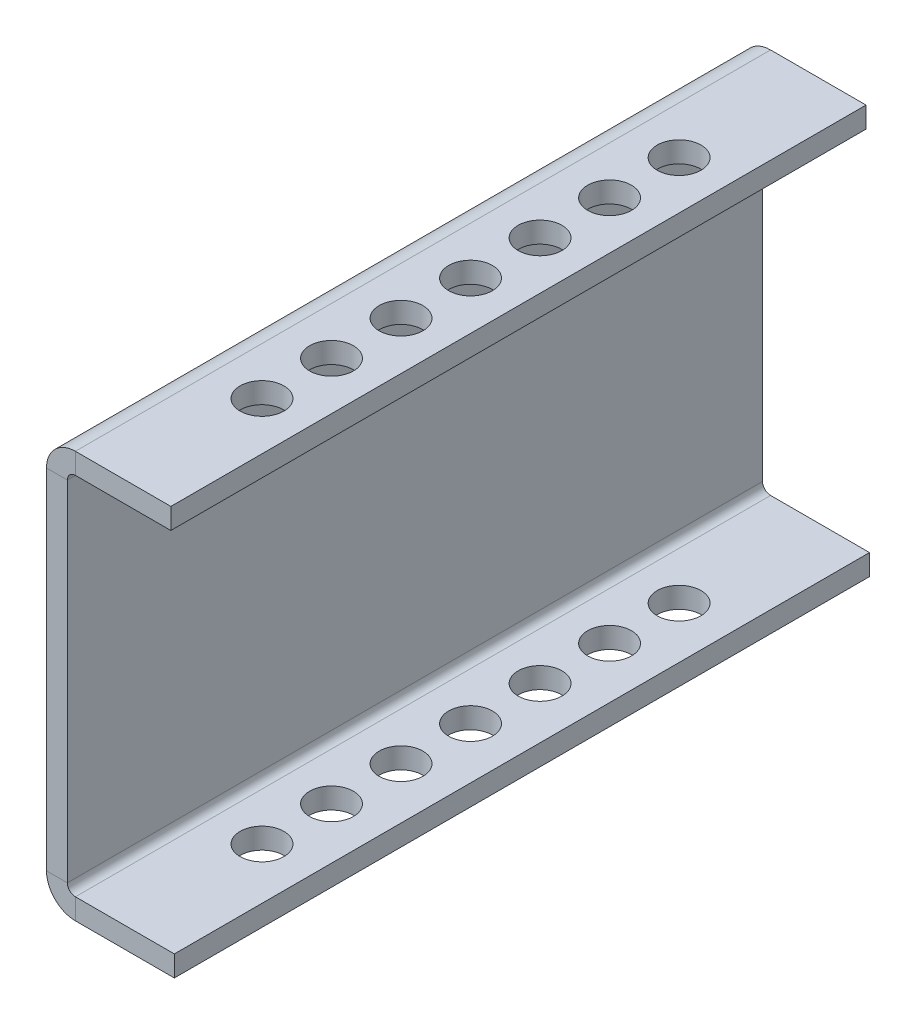
from build123d import *

# Parameters (mm, degrees)
SKETCH4_W              = 63.5
SKETCH4_H              = 54.9275
BASE_FLANGE1_DEPTH     = 1.905
SKETCHED_START         = -31.75
SKETCHED_BEND3_DEPTH   = 63.5
SKETCHED_BEND3_2_DEPTH = 63.5
CUT_EXTRUDE2_REACH     = 51.835
SKETCH20_R             = 2


# Read off the part's stored shape, not the designer's step: Sketched Bend3
# Sheet-metal steps are written as plain solids
with BuildPart() as part:
    # Sketch4 → Base-Flange1 (new body)
    with BuildSketch(Plane(origin=(0, 0, 0), x_dir=(0, 0, -1), z_dir=(1, 0, 0))):
        Rectangle(SKETCH4_W, SKETCH4_H)
    extrude(amount=-BASE_FLANGE1_DEPTH)

    # Sketched Bend3 outline → Sketched Bend3 (cut)
    with BuildSketch(Plane.XY.offset(SKETCHED_START)):
        with BuildLine():
            ThreePointArc((0, -18.310223013), (-1.375727285, -17.359629491), (-1.905, -15.7734))
            Line((-1.905, -15.7734), (-1.905, -27.46375))
            Line((-1.905, -27.46375), (0, -27.46375))
            Line((0, -27.46375), (0, -18.310223013))
        make_face()
        with BuildLine():
            Line((-1.905, 27.46375), (-1.905, 16.0909))
            ThreePointArc((-1.905, 16.0909), (-1.375727285, 17.677129491), (0, 18.627723013))
            Line((0, 18.627723013), (0, 27.46375))
            Line((0, 27.46375), (-1.905, 27.46375))
        make_face()
    extrude(amount=SKETCHED_BEND3_DEPTH, mode=Mode.SUBTRACT)

    # Sketched Bend3 2 outline → Sketched Bend3 2 (add)
    with BuildSketch(Plane.XY.offset(SKETCHED_START)):
        with BuildLine():
            Line((0, -15.7734), (0, -18.310223013))
            ThreePointArc((0, -18.310223013), (0.364592683, -18.388674577), (0.7366, -18.415))
            Line((0.7366, -18.415), (9.773717924, -18.415))
            Line((9.773717924, -18.415), (9.773717924, -16.51))
            Line((9.773717924, -16.51), (0.7366, -16.51))
            ThreePointArc((0.7366, -16.51), (0.215745145, -16.294254855), (0, -15.7734))
        make_face()
        with BuildLine():
            ThreePointArc((0.7366, 18.7325), (0.364592683, 18.706174577), (0, 18.627723013))
            Line((0, 18.627723013), (0, 16.0909))
            ThreePointArc((0, 16.0909), (0.215745145, 16.611754855), (0.7366, 16.8275))
            Line((0.7366, 16.8275), (9.456217924, 16.8275))
            Line((9.456217924, 16.8275), (9.456217924, 18.7325))
            Line((9.456217924, 18.7325), (0.7366, 18.7325))
        make_face()
    extrude(amount=SKETCHED_BEND3_2_DEPTH)

    # Cut-Extrude2: up to this face of the body (flat: up to its plane)
    cut_extrude2_end = Plane(part.part.faces().sort_by_distance((5.255158962, -18.415, 0))[0])
    # Sketch20 → Cut-Extrude2 (cut, up to the picked face)
    with BuildSketch(Plane(origin=(0, 18.7325, 0), x_dir=(1, 0, 0), z_dir=(0, 1, 0)), mode=Mode.PRIVATE) as cut_extrude2_sk1:
        with Locations(Location((5.08, -6.35, 0), (0, 0, 180))):
            Circle(SKETCH20_R)
    cut_extrude2_tool1 = split(extrude(cut_extrude2_sk1.sketch, amount=-CUT_EXTRUDE2_REACH, mode=Mode.PRIVATE), bisect_by=cut_extrude2_end, keep=Keep.BOTH, mode=Mode.PRIVATE)
    # Sketch20 → Cut-Extrude2 (cut, up to the picked face)
    with BuildSketch(Plane(origin=(0, 18.7325, 0), x_dir=(1, 0, 0), z_dir=(0, 1, 0)), mode=Mode.PRIVATE) as cut_extrude2_sk2:
        with Locations(Location((5.08, 0, 0), (0, 0, 180))):
            Circle(SKETCH20_R)
    cut_extrude2_tool2 = split(extrude(cut_extrude2_sk2.sketch, amount=-CUT_EXTRUDE2_REACH, mode=Mode.PRIVATE), bisect_by=cut_extrude2_end, keep=Keep.BOTH, mode=Mode.PRIVATE)
    # Sketch20 → Cut-Extrude2 (cut, up to the picked face)
    with BuildSketch(Plane(origin=(0, 18.7325, 0), x_dir=(1, 0, 0), z_dir=(0, 1, 0)), mode=Mode.PRIVATE) as cut_extrude2_sk3:
        with Locations(Location((5.08, 6.35, 0), (0, 0, 180))):
            Circle(SKETCH20_R)
    cut_extrude2_tool3 = split(extrude(cut_extrude2_sk3.sketch, amount=-CUT_EXTRUDE2_REACH, mode=Mode.PRIVATE), bisect_by=cut_extrude2_end, keep=Keep.BOTH, mode=Mode.PRIVATE)
    # Sketch20 → Cut-Extrude2 (cut, up to the picked face)
    with BuildSketch(Plane(origin=(0, 18.7325, 0), x_dir=(1, 0, 0), z_dir=(0, 1, 0)), mode=Mode.PRIVATE) as cut_extrude2_sk4:
        with Locations(Location((5.08, 12.7, 0), (0, 0, 180))):
            Circle(SKETCH20_R)
    cut_extrude2_tool4 = split(extrude(cut_extrude2_sk4.sketch, amount=-CUT_EXTRUDE2_REACH, mode=Mode.PRIVATE), bisect_by=cut_extrude2_end, keep=Keep.BOTH, mode=Mode.PRIVATE)
    # Sketch20 → Cut-Extrude2 (cut, up to the picked face)
    with BuildSketch(Plane(origin=(0, 18.7325, 0), x_dir=(1, 0, 0), z_dir=(0, 1, 0)), mode=Mode.PRIVATE) as cut_extrude2_sk5:
        with Locations(Location((5.08, 19.05, 0), (0, 0, 180))):
            Circle(SKETCH20_R)
    cut_extrude2_tool5 = split(extrude(cut_extrude2_sk5.sketch, amount=-CUT_EXTRUDE2_REACH, mode=Mode.PRIVATE), bisect_by=cut_extrude2_end, keep=Keep.BOTH, mode=Mode.PRIVATE)
    # Sketch20 → Cut-Extrude2 (cut, up to the picked face)
    with BuildSketch(Plane(origin=(0, 18.7325, 0), x_dir=(1, 0, 0), z_dir=(0, 1, 0)), mode=Mode.PRIVATE) as cut_extrude2_sk6:
        with Locations(Location((5.08, -12.7, 0), (0, 0, 180))):
            Circle(SKETCH20_R)
    cut_extrude2_tool6 = split(extrude(cut_extrude2_sk6.sketch, amount=-CUT_EXTRUDE2_REACH, mode=Mode.PRIVATE), bisect_by=cut_extrude2_end, keep=Keep.BOTH, mode=Mode.PRIVATE)
    # Sketch20 → Cut-Extrude2 (cut, up to the picked face)
    with BuildSketch(Plane(origin=(0, 18.7325, 0), x_dir=(1, 0, 0), z_dir=(0, 1, 0)), mode=Mode.PRIVATE) as cut_extrude2_sk7:
        with Locations(Location((5.08, -19.05, 0), (0, 0, 180))):
            Circle(SKETCH20_R)
    cut_extrude2_tool7 = split(extrude(cut_extrude2_sk7.sketch, amount=-CUT_EXTRUDE2_REACH, mode=Mode.PRIVATE), bisect_by=cut_extrude2_end, keep=Keep.BOTH, mode=Mode.PRIVATE)
    add(cut_extrude2_tool1.solids().sort_by(Axis((5.08, 18.7325, 6.35), (0, -1, 0)))[0], mode=Mode.SUBTRACT)
    add(cut_extrude2_tool2.solids().sort_by(Axis((5.08, 18.7325, 0), (0, -1, 0)))[0], mode=Mode.SUBTRACT)
    add(cut_extrude2_tool3.solids().sort_by(Axis((5.08, 18.7325, -6.35), (0, -1, 0)))[0], mode=Mode.SUBTRACT)
    add(cut_extrude2_tool4.solids().sort_by(Axis((5.08, 18.7325, -12.7), (0, -1, 0)))[0], mode=Mode.SUBTRACT)
    add(cut_extrude2_tool5.solids().sort_by(Axis((5.08, 18.7325, -19.05), (0, -1, 0)))[0], mode=Mode.SUBTRACT)
    add(cut_extrude2_tool6.solids().sort_by(Axis((5.08, 18.7325, 12.7), (0, -1, 0)))[0], mode=Mode.SUBTRACT)
    add(cut_extrude2_tool7.solids().sort_by(Axis((5.08, 18.7325, 19.05), (0, -1, 0)))[0], mode=Mode.SUBTRACT)


solid = part.part
